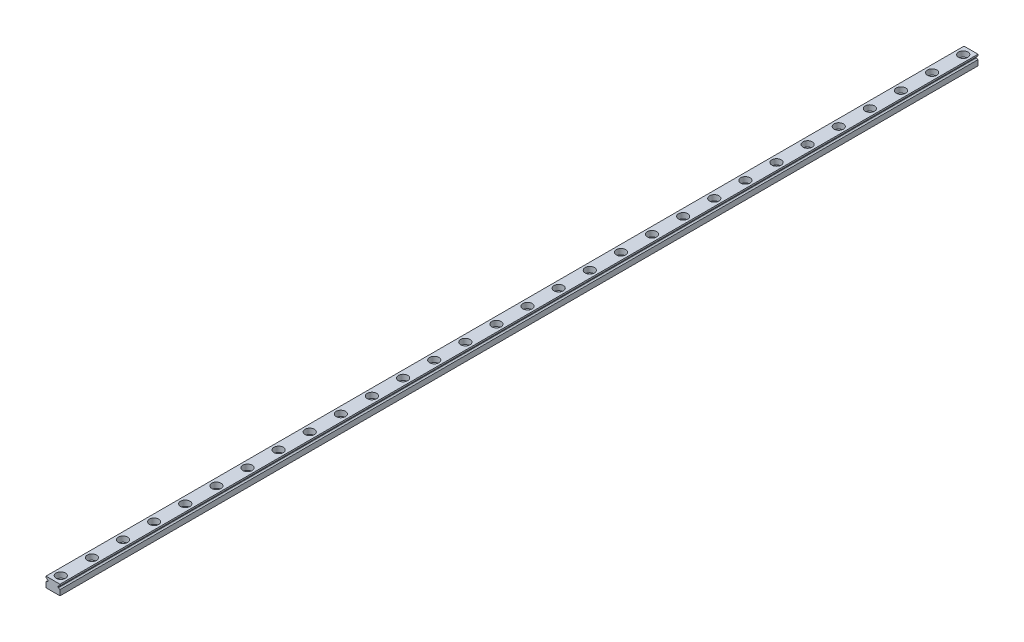
from build123d import *

# Parameters (mm, degrees)
EXTRUDE1_DEPTH  = 590
SKETCH2_R       = 3
EXTRUDE2_DEPTH  = 3.5
SKETCH_R        = 1.75
EXTRUDE3_DEPTH  = 591.052963724
LPATTERN1_COUNT = 30
LPATTERN1_PITCH = 20


with BuildPart() as part:
    # Sketch1 → Extrude1 (new body)
    with BuildSketch(Plane.XY):
        with BuildLine():
            Line((-4.5, -3.25), (4.5, -3.25))
            Line((4.5, -3.25), (4.5, 0.25))
            ThreePointArc((4.5, 0.25), (3.93077967, 0.427814974), (3.563991137, 0.898023568))
            Line((3.563991137, 0.898023568), (3.235073025, 0.898023568))
            Line((3.235073025, 0.898023568), (3.235073025, 1.601976432))
            Line((3.235073025, 1.601976432), (3.563991137, 1.601976432))
            ThreePointArc((3.563991137, 1.601976432), (3.93077967, 2.072185026), (4.5, 2.25))
            Line((4.5, 2.25), (4.5, 3.25))
            Line((4.5, 3.25), (-4.5, 3.25))
            Line((-4.5, 3.25), (-4.5, 2.25))
            ThreePointArc((-4.5, 2.25), (-3.93077967, 2.072185026), (-3.563991137, 1.601976432))
            Line((-3.563991137, 1.601976432), (-3.235073025, 1.601976432))
            Line((-3.235073025, 1.601976432), (-3.235073025, 0.898023568))
            Line((-3.235073025, 0.898023568), (-3.563991137, 0.898023568))
            ThreePointArc((-3.563991137, 0.898023568), (-3.93077967, 0.427814974), (-4.5, 0.25))
            Line((-4.5, 0.25), (-4.5, -3.25))
        make_face()
    extrude(amount=EXTRUDE1_DEPTH)

    # Sketch2 → Extrude2 (cut)
    with BuildSketch(Plane(origin=(0, 3.25, 0), x_dir=(1, 0, 0), z_dir=(0, 1, 0))):
        with Locations((0, -5)):
            Circle(SKETCH2_R)
    extrude2 = extrude(amount=-EXTRUDE2_DEPTH, mode=Mode.SUBTRACT)

    # Sketch → Extrude3 (cut, through all)
    with BuildSketch(Plane(origin=(0, 3.25, 0), x_dir=(1, 0, 0), z_dir=(0, 1, 0))):
        with Locations((0, -5)):
            Circle(SKETCH_R)
    extrude3 = extrude(amount=-EXTRUDE3_DEPTH, mode=Mode.SUBTRACT)

    # LPattern1: Extrude2, Extrude3 ×30
    with Locations(*[(0, 0, i * LPATTERN1_PITCH) for i in range(1, LPATTERN1_COUNT)]):
        add(extrude2, mode=Mode.SUBTRACT)
        add(extrude3, mode=Mode.SUBTRACT)


solid = part.part
